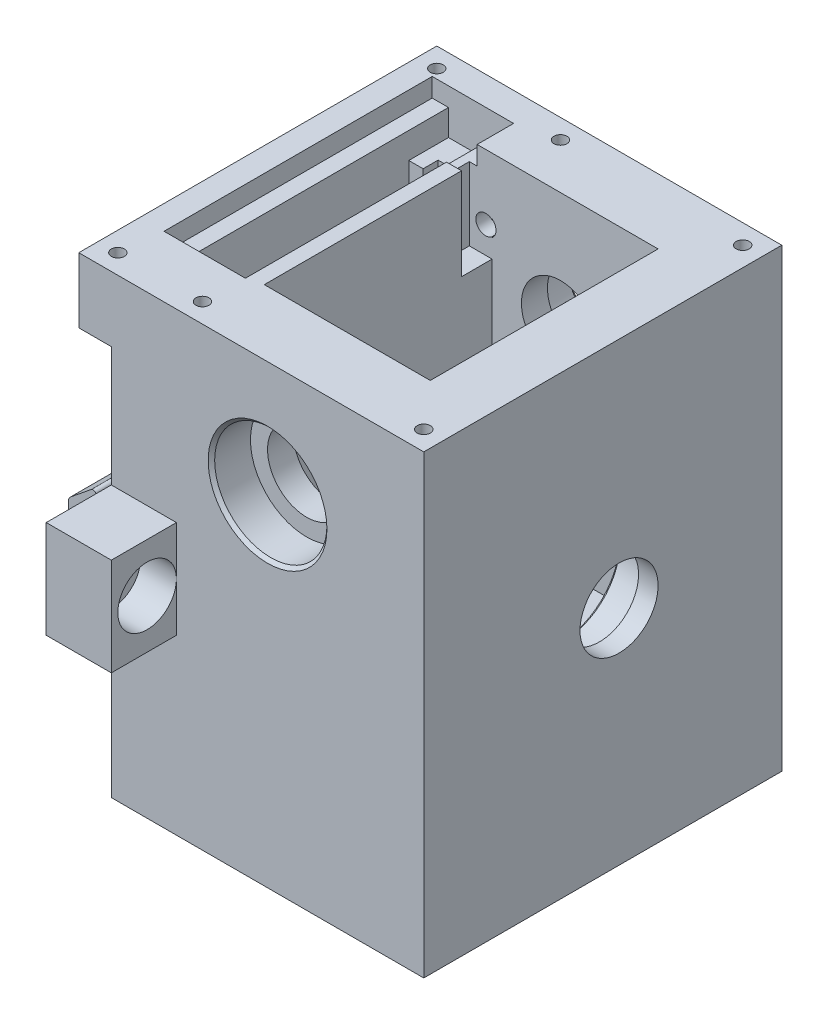
from build123d import *

# Parameters (mm, degrees)
SKETCH1_W            = 48
SKETCH1_H            = 70
BOSS_EXTRUDE1_DEPTH  = 80
SKETCH2_W            = 33
SKETCH2_H            = 69.5
CUT_EXTRUDE1_DEPTH   = 62.5
SKETCH3_W            = 2.3
SKETCH3_H            = 5
BOSS_EXTRUDE2_DEPTH  = 80
SKETCH5_W            = 4.3
SKETCH5_H            = 12
BOSS_EXTRUDE4_DEPTH  = 80
CUT_EXTRUDE2_DEPTH   = 80
CUT_EXTRUDE3_DEPTH   = 80
FILLET1_R            = 1
FILLET2_R            = 1
FILLET3_R            = 0.5
FILLET4_R            = 0.5
SKETCH9_W            = 13
SKETCH9_H            = 62.5
CUT_EXTRUDE4_DEPTH   = 10
SKETCH10_R           = 1.6
CUT_EXTRUDE5_DEPTH   = 20
SKETCH11_R           = 1.6
CUT_EXTRUDE6_DEPTH   = 10
SKETCH12_R           = 1.6
CUT_EXTRUDE7_DEPTH   = 10
SKETCH13_R           = 1.6
CUT_EXTRUDE8_DEPTH   = 10
BOSS_EXTRUDE5_DEPTH  = 62.5
SKETCH10_2_R         = 1.6
CUT_EXTRUDE9_DEPTH   = 39.5
SKETCH11_2_R         = 1.6
CUT_EXTRUDE10_DEPTH  = 39.5
SKETCH12_2_R         = 1.6
CUT_EXTRUDE11_DEPTH  = 39.5
SKETCH13_2_R         = 1.6
CUT_EXTRUDE12_DEPTH  = 39.5
SKETCH18_R           = 8.625
CUT_EXTRUDE14_DEPTH  = 48
SKETCH19_W           = 61.257664064
SKETCH19_H           = 71.270088678
CUT_EXTRUDE15_DEPTH  = 25
SKETCH20_W           = 33
SKETCH20_H           = 8
BOSS_EXTRUDE6_DEPTH  = 62.5
SKETCH16_R           = 8.625
CUT_EXTRUDE13_DEPTH  = 89.5
SKETCH28_R           = 11.5
BOSS_EXTRUDE8_DEPTH  = 11
SKETCH30_W           = 47.795163584
SKETCH30_H           = 26.72
BOSS_EXTRUDE9_DEPTH  = 11
SKETCH18_2_R         = 8.625
CUT_EXTRUDE17_DEPTH  = 45
SKETCH31_W           = 26.665859589
SKETCH31_H           = 27.00483238
BOSS_EXTRUDE10_DEPTH = 7.5
SKETCH32_R           = 9.5
BOSS_EXTRUDE11_DEPTH = 4
SKETCH35_R           = 2.5
CUT_EXTRUDE20_DEPTH  = 3
BOSS_EXTRUDE12_START = 6
BOSS_EXTRUDE12_DEPTH = 6
SKETCH48_R           = 8.675
CUT_EXTRUDE30_DEPTH  = 7
CHAMFER1_SIZE        = 0.5
SKETCH49_W           = 7.2
SKETCH49_H           = 28.2
CUT_EXTRUDE31_DEPTH  = 47.98
SKETCH50_W           = 7.2
SKETCH50_H           = 6
CUT_EXTRUDE32_DEPTH  = 6.88
SKETCH51_W           = 7.2
SKETCH51_H           = 6
CUT_EXTRUDE33_DEPTH  = 6.88
CHAMFER3_SIZE        = 1
SKETCH56_W           = 4.696998891
SKETCH56_H           = 14.096677865
CUT_EXTRUDE38_DEPTH  = 3.5
SKETCH57_R           = 1.5
CUT_EXTRUDE39_DEPTH  = 8
SKETCH58_W           = 55
SKETCH58_H           = 10
BOSS_EXTRUDE13_DEPTH = 5
SKETCH59_W           = 46.671424446
SKETCH59_H           = 12.802635134
BOSS_EXTRUDE14_DEPTH = 25
SKETCH12_3_R         = 1.6
CUT_EXTRUDE41_DEPTH  = 12
SKETCH61_R           = 1
CUT_EXTRUDE42_DEPTH  = 10
SKETCH62_R           = 1
CUT_EXTRUDE43_DEPTH  = 10
SKETCH63_R           = 1
CUT_EXTRUDE44_DEPTH  = 10
SKETCH64_R           = 1
CUT_EXTRUDE45_DEPTH  = 10
SKETCH65_R           = 1
CUT_EXTRUDE46_DEPTH  = 10
SKETCH66_R           = 1
CUT_EXTRUDE47_DEPTH  = 10
SKETCH67_W           = 10
SKETCH67_H           = 10
CUT_EXTRUDE48_DEPTH  = 15
SKETCH68_W           = 10
SKETCH68_H           = 10
CUT_EXTRUDE49_DEPTH  = 15
SKETCH13_3_R         = 1.6
CUT_EXTRUDE50_DEPTH  = 15
SKETCH69_W           = 0.2
SKETCH69_H           = 40.2
CUT_EXTRUDE51_DEPTH  = 47.98
SKETCH71_W           = 0.2
SKETCH71_H           = 6
BOSS_EXTRUDE15_DEPTH = 41.1
SKETCH72_W           = 0.2
SKETCH72_H           = 6
BOSS_EXTRUDE16_DEPTH = 41.1
SKETCH73_W           = 0.2
SKETCH73_H           = 40.2
CUT_EXTRUDE52_DEPTH  = 47.98
SKETCH74_W           = 0.2
SKETCH74_H           = 6
BOSS_EXTRUDE17_DEPTH = 41.1
SKETCH75_W           = 0.2
SKETCH75_H           = 6
BOSS_EXTRUDE18_DEPTH = 41.1
SKETCH76_W           = 7.6
SKETCH76_H           = 0.4
CUT_EXTRUDE53_DEPTH  = 41.1
SKETCH77_W           = 7.6
SKETCH77_H           = 0.4
CUT_EXTRUDE54_DEPTH  = 41.1
SKETCH81_W           = 44.833246721
SKETCH81_H           = 50.686044519
BOSS_EXTRUDE19_DEPTH = 1.5
SKETCH18_3_R         = 8.625
CUT_EXTRUDE57_DEPTH  = 12
SKETCH82_W           = 10
SKETCH82_H           = 15
BOSS_EXTRUDE20_DEPTH = 15
SKETCH85_W           = 7.6
SKETCH85_H           = 0.5
CUT_EXTRUDE60_DEPTH  = 6.88
SKETCH86_W           = 7.6
SKETCH86_H           = 0.5
CUT_EXTRUDE61_DEPTH  = 6.88
SKETCH87_R           = 4.5
CUT_EXTRUDE62_DEPTH  = 5.5
SKETCH88_R           = 2.5
CUT_EXTRUDE63_DEPTH  = 5.5
SKETCH89_W           = 5
SKETCH89_H           = 15
CUT_EXTRUDE64_DEPTH  = 15.5
SKETCH96_W           = 2.4
SKETCH96_H           = 2.3
CUT_EXTRUDE69_DEPTH  = 41
SKETCH97_W           = 2.4
SKETCH97_H           = 2.3
CUT_EXTRUDE70_DEPTH  = 41
SKETCH98_R           = 1
CUT_EXTRUDE71_DEPTH  = 10
SKETCH99_R           = 1
CUT_EXTRUDE72_DEPTH  = 10
SKETCH101_W          = 43.155587502
SKETCH101_H          = 54.303115044
BOSS_EXTRUDE23_DEPTH = 0.1
SKETCH105_R          = 8.625
BOSS_EXTRUDE26_DEPTH = 2
BOSS_EXTRUDE27_START = -2
SKETCH106_R          = 8.625
BOSS_EXTRUDE27_DEPTH = 2
SKETCH107_R          = 6
CUT_EXTRUDE74_DEPTH  = 52
CHAMFER4_SIZE        = 0.5
CHAMFER5_SIZE        = 0.5
CHAMFER6_SIZE        = 0.5
SKETCH108_R          = 8.675
BOSS_EXTRUDE28_DEPTH = 3
SKETCH110_R          = 6
CUT_EXTRUDE75_DEPTH  = 3
SKETCH111_W          = 2.5
SKETCH111_H          = 41.2
CUT_EXTRUDE76_DEPTH  = 2.88
SKETCH112_W          = 2.5
SKETCH112_H          = 41.2
CUT_EXTRUDE77_DEPTH  = 2.88
BOSS_EXTRUDE30_START = 0.8
SKETCH114_R          = 8.675
SKETCH114_R_2        = 2.5
BOSS_EXTRUDE30_DEPTH = 0.8
CHAMFER7_SIZE        = 0.5
CHAMFER8_SIZE        = 0.5
SKETCH115_R          = 6
SKETCH115_R_2        = 1.6
BOSS_EXTRUDE31_DEPTH = 2
CUT_EXTRUDE78_DEPTH  = 2
SKETCH117_R          = 6
BOSS_EXTRUDE32_DEPTH = 2
SKETCH119_R          = 1.6
CUT_EXTRUDE80_DEPTH  = 10


with BuildPart() as part:
    # Sketch1 → Boss-Extrude1 (new body)
    with BuildSketch(Plane.XY):
        with Locations((24, 35)):
            Rectangle(SKETCH1_W, SKETCH1_H)
    extrude(amount=BOSS_EXTRUDE1_DEPTH)

    # Sketch2 → Cut-Extrude1 (cut)
    with BuildSketch(Plane(origin=(0, 70, 0), x_dir=(1, 0, 0), z_dir=(0, 1, 0))):
        with Locations((24, -37.75)):
            Rectangle(SKETCH2_W, SKETCH2_H)
    extrude(amount=-CUT_EXTRUDE1_DEPTH, mode=Mode.SUBTRACT)

    # Sketch3 → Boss-Extrude2 (add)
    with BuildSketch(Plane.XY.offset(80)):
        with Locations((-1.15, 34.096547)):
            Rectangle(SKETCH3_W, SKETCH3_H)
    extrude(amount=-BOSS_EXTRUDE2_DEPTH)

    # Sketch5 → Boss-Extrude4 (add)
    with BuildSketch(Plane.XY.offset(80)):
        with Locations((-4.45, 34.096547)):
            Rectangle(SKETCH5_W, SKETCH5_H)
    extrude(amount=-BOSS_EXTRUDE4_DEPTH)

    # Sketch6 → Cut-Extrude2 (cut)
    with BuildSketch(Plane.XY.offset(80)):
        Polygon((-2.3, 40.096547), (-6.6, 36.596547), (-6.6, 40.096547), align=None)
    extrude(amount=-CUT_EXTRUDE2_DEPTH, mode=Mode.SUBTRACT)

    # Sketch7 → Cut-Extrude3 (cut)
    with BuildSketch(Plane.XY.offset(80)):
        Polygon((-6.6, 28.096547), (-2.3, 28.096547), (-6.6, 31.596547), align=None)
    extrude(amount=-CUT_EXTRUDE3_DEPTH, mode=Mode.SUBTRACT)

    # Fillet1
    fillet1_edges = [part.edges().sort_by_distance(p)[0] for p in [
        (-6.6, 36.596547, 40),
    ]]
    fillet(fillet1_edges, radius=FILLET1_R)

    # Fillet2
    fillet2_edges = [part.edges().sort_by_distance(p)[0] for p in [
        (-6.6, 31.596547, 40),
    ]]
    fillet(fillet2_edges, radius=FILLET2_R)

    # Fillet3
    fillet3_edges = [part.edges().sort_by_distance(p)[0] for p in [
        (-2.3, 40.096547, 40),
    ]]
    fillet(fillet3_edges, radius=FILLET3_R)

    # Fillet4
    fillet4_edges = [part.edges().sort_by_distance(p)[0] for p in [
        (-2.3, 28.096547, 40),
    ]]
    fillet(fillet4_edges, radius=FILLET4_R)

    # Sketch9 → Cut-Extrude4 (cut)
    with BuildSketch(Plane(origin=(0, 0, 0), x_dir=(-1, 0, 0), z_dir=(0, 0, -1))):
        with Locations((-24, 38.75)):
            Rectangle(SKETCH9_W, SKETCH9_H)
    extrude(amount=-CUT_EXTRUDE4_DEPTH, mode=Mode.SUBTRACT)

    # Sketch10 → Cut-Extrude5 (cut)
    with BuildSketch(Plane(origin=(0, 0, 0), x_dir=(-1, 0, 0), z_dir=(0, 0, -1))):
        with Locations((-12.5, 60)):
            Circle(SKETCH10_R)
    extrude(amount=-CUT_EXTRUDE5_DEPTH, mode=Mode.SUBTRACT)

    # Sketch11 → Cut-Extrude6 (cut)
    with BuildSketch(Plane(origin=(0, 0, 0), x_dir=(-1, 0, 0), z_dir=(0, 0, -1))):
        with Locations((-35.5, 60)):
            Circle(SKETCH11_R)
    extrude(amount=-CUT_EXTRUDE6_DEPTH, mode=Mode.SUBTRACT)

    # Sketch12 → Cut-Extrude7 (cut)
    with BuildSketch(Plane(origin=(0, 0, 0), x_dir=(-1, 0, 0), z_dir=(0, 0, -1))):
        with Locations((-12.5, 10)):
            Circle(SKETCH12_R)
    extrude(amount=-CUT_EXTRUDE7_DEPTH, mode=Mode.SUBTRACT)

    # Sketch13 → Cut-Extrude8 (cut)
    with BuildSketch(Plane(origin=(0, 0, 0), x_dir=(-1, 0, 0), z_dir=(0, 0, -1))):
        with Locations((-35.5, 10)):
            Circle(SKETCH13_R)
    extrude(amount=-CUT_EXTRUDE8_DEPTH, mode=Mode.SUBTRACT)

    # Sketch15 → Boss-Extrude5 (add)
    with BuildSketch(Plane(origin=(0, 7.5, 0), x_dir=(1, 0, 0), z_dir=(0, 1, 0))):
        Polygon((40.5, -3), (40.5, -8), (7.5, -8), (7.5, -3), (17.5, -3), (17.5, 0), (30.5, 0), (30.5, -3), align=None)
    extrude(amount=BOSS_EXTRUDE5_DEPTH)

    # Sketch10<2> → Cut-Extrude9 (cut)
    with BuildSketch(Plane(origin=(0, 0, 0), x_dir=(-1, 0, 0), z_dir=(0, 0, -1))):
        with Locations((-12.5, 60)):
            Circle(SKETCH10_2_R)
    extrude(amount=-CUT_EXTRUDE9_DEPTH, mode=Mode.SUBTRACT)

    # Sketch11<2> → Cut-Extrude10 (cut)
    with BuildSketch(Plane(origin=(0, 0, 0), x_dir=(-1, 0, 0), z_dir=(0, 0, -1))):
        with Locations((-35.5, 60)):
            Circle(SKETCH11_2_R)
    extrude(amount=-CUT_EXTRUDE10_DEPTH, mode=Mode.SUBTRACT)

    # Sketch12<2> → Cut-Extrude11 (cut)
    with BuildSketch(Plane(origin=(0, 0, 0), x_dir=(-1, 0, 0), z_dir=(0, 0, -1))):
        with Locations((-12.5, 10)):
            Circle(SKETCH12_2_R)
    extrude(amount=-CUT_EXTRUDE11_DEPTH, mode=Mode.SUBTRACT)

    # Sketch13<2> → Cut-Extrude12 (cut)
    with BuildSketch(Plane(origin=(0, 0, 0), x_dir=(-1, 0, 0), z_dir=(0, 0, -1))):
        with Locations((-35.5, 10)):
            Circle(SKETCH13_2_R)
    extrude(amount=-CUT_EXTRUDE12_DEPTH, mode=Mode.SUBTRACT)

    # Sketch18 → Cut-Extrude14 (cut)
    with BuildSketch(Plane(origin=(48, 0, 0), x_dir=(0, 0, -1), z_dir=(1, 0, 0))):
        with Locations(Location((-25, 34.22, 0), (0, 0, 15.994297416))):
            Circle(SKETCH18_R)
    extrude(amount=-CUT_EXTRUDE14_DEPTH, mode=Mode.SUBTRACT)

    # Sketch19 → Cut-Extrude15 (cut)
    with BuildSketch(Plane.XY.offset(80)):
        with Locations((17.371167968, 35.635044339)):
            Rectangle(SKETCH19_W, SKETCH19_H)
    extrude(amount=-CUT_EXTRUDE15_DEPTH, mode=Mode.SUBTRACT)

    # Sketch20 → Boss-Extrude6 (add)
    with BuildSketch(Plane(origin=(0, 7.5, 0), x_dir=(1, 0, 0), z_dir=(0, 1, 0))):
        with Locations((24, -51)):
            Rectangle(SKETCH20_W, SKETCH20_H)
    extrude(amount=BOSS_EXTRUDE6_DEPTH)

    # Sketch16 → Cut-Extrude13 (cut)
    with BuildSketch(Plane(origin=(0, 0, 0), x_dir=(-1, 0, 0), z_dir=(0, 0, -1))):
        with Locations((-24, 52.3)):
            Circle(SKETCH16_R)
    extrude(amount=-CUT_EXTRUDE13_DEPTH, mode=Mode.SUBTRACT)

    # Sketch28 → Boss-Extrude8 (add)
    with BuildSketch(Plane(origin=(7.5, 0, 0), x_dir=(0, 0, -1), z_dir=(1, 0, 0))):
        with Locations(Location((-25, 34.22, 0), (0, 0, 180))):
            Circle(SKETCH28_R)
    extrude(amount=BOSS_EXTRUDE8_DEPTH)

    # Sketch30 → Boss-Extrude9 (add)
    with BuildSketch(Plane(origin=(7.5, 0, 0), x_dir=(0, 0, -1), z_dir=(1, 0, 0))):
        with Locations((-27.782477326, 20.86)):
            Rectangle(SKETCH30_W, SKETCH30_H)
    extrude(amount=BOSS_EXTRUDE9_DEPTH)

    # Sketch18<2> → Cut-Extrude17 (cut)
    with BuildSketch(Plane(origin=(48, 0, 0), x_dir=(0, 0, -1), z_dir=(1, 0, 0))):
        with Locations((-25, 34.22)):
            Circle(SKETCH18_2_R)
    extrude(amount=-CUT_EXTRUDE17_DEPTH, mode=Mode.SUBTRACT)

    # Sketch31 → Boss-Extrude10 (add)
    with BuildSketch(Plane.ZY):
        with Locations((25.47457292, 33.7006043)):
            Rectangle(SKETCH31_W, SKETCH31_H)
    extrude(amount=-BOSS_EXTRUDE10_DEPTH)

    # Sketch32 → Boss-Extrude11 (add)
    with BuildSketch(Plane(origin=(7.5, 0, 0), x_dir=(0, 0, -1), z_dir=(1, 0, 0))):
        with Locations((-25, 34.22)):
            Circle(SKETCH32_R)
    extrude(amount=BOSS_EXTRUDE11_DEPTH)

    # Sketch35 → Cut-Extrude20 (cut)
    with BuildSketch(Plane(origin=(11.5, 0, 0), x_dir=(0, 0, -1), z_dir=(1, 0, 0))):
        with Locations((-25, 34.22)):
            Circle(SKETCH35_R)
    extrude(amount=-CUT_EXTRUDE20_DEPTH, mode=Mode.SUBTRACT)

    # Sketch38 → Boss-Extrude12 (add)
    with BuildSketch(Plane(origin=(7.5, 0, 0), x_dir=(0, 0, -1), z_dir=(1, 0, 0)).offset(BOSS_EXTRUDE12_START)):
        with BuildLine():
            Line((-33.625, 34.22), (-55, 34.22))
            Line((-55, 34.22), (-55, 70))
            Line((-55, 70), (0, 70))
            Line((0, 70), (0, 34.22))
            Line((0, 34.22), (-16.375, 34.22))
            ThreePointArc((-16.375, 34.22), (-25, 42.845), (-33.625, 34.22))
        make_face()
    extrude(amount=-BOSS_EXTRUDE12_DEPTH)

    # Sketch48 → Cut-Extrude30 (cut)
    with BuildSketch(Plane(origin=(18.5, 0, 0), x_dir=(0, 0, -1), z_dir=(1, 0, 0))):
        with Locations((-25, 34.22)):
            Circle(SKETCH48_R)
    extrude(amount=-CUT_EXTRUDE30_DEPTH, mode=Mode.SUBTRACT)

    # Chamfer1
    chamfer1_edges = [part.edges().sort_by_distance(p)[0] for p in [
        (18.5, 34.22, 33.675),
    ]]
    chamfer(chamfer1_edges, length=CHAMFER1_SIZE)

    # Sketch49 → Cut-Extrude31 (cut)
    with BuildSketch(Plane(origin=(0, 70, 0), x_dir=(1, 0, 0), z_dir=(0, 1, 0))):
        with Locations((4.9, -25)):
            Rectangle(SKETCH49_W, SKETCH49_H)
    extrude(amount=-CUT_EXTRUDE31_DEPTH, mode=Mode.SUBTRACT)

    # Sketch50 → Cut-Extrude32 (cut)
    with BuildSketch(Plane(origin=(0, 70, 0), x_dir=(1, 0, 0), z_dir=(0, 1, 0))):
        with Locations((4.9, -7.9)):
            Rectangle(SKETCH50_W, SKETCH50_H)
    extrude(amount=-CUT_EXTRUDE32_DEPTH, mode=Mode.SUBTRACT)

    # Sketch51 → Cut-Extrude33 (cut)
    with BuildSketch(Plane(origin=(0, 70, 0), x_dir=(1, 0, 0), z_dir=(0, 1, 0))):
        with Locations((4.9, -42.1)):
            Rectangle(SKETCH51_W, SKETCH51_H)
    extrude(amount=-CUT_EXTRUDE33_DEPTH, mode=Mode.SUBTRACT)

    # Chamfer3
    chamfer3_edges = [part.edges().sort_by_distance(p)[0] for p in [
        (18.5, 45.72, 25),
    ]]
    chamfer(chamfer3_edges, length=CHAMFER3_SIZE)

    # Sketch56 → Cut-Extrude38 (cut)
    with BuildSketch(Plane(origin=(13.5, 0, 0), x_dir=(0, 0, -1), z_dir=(1, 0, 0))):
        with Locations((-10.348499445, 62.951661067)):
            Rectangle(SKETCH56_W, SKETCH56_H)
    extrude(amount=-CUT_EXTRUDE38_DEPTH, mode=Mode.SUBTRACT)

    # Sketch57 → Cut-Extrude39 (cut)
    with BuildSketch(Plane(origin=(0, 0, 0), x_dir=(-1, 0, 0), z_dir=(0, 0, -1))):
        with Locations((-12.5, 60)):
            Circle(SKETCH57_R)
    extrude(amount=-CUT_EXTRUDE39_DEPTH, mode=Mode.SUBTRACT)

    # Sketch58 → Boss-Extrude13 (add)
    with BuildSketch(Plane.ZY):
        with Locations((27.5, 65)):
            Rectangle(SKETCH58_W, SKETCH58_H)
    extrude(amount=BOSS_EXTRUDE13_DEPTH)

    # Sketch59 → Boss-Extrude14 (add)
    with BuildSketch(Plane(origin=(18.5, 0, 0), x_dir=(0, 0, -1), z_dir=(1, 0, 0))):
        with Locations((-28.603153, 13.347248395)):
            Rectangle(SKETCH59_W, SKETCH59_H)
    extrude(amount=BOSS_EXTRUDE14_DEPTH)

    # Sketch12<3> → Cut-Extrude41 (cut)
    with BuildSketch(Plane(origin=(0, 0, 0), x_dir=(-1, 0, 0), z_dir=(0, 0, -1))):
        with Locations((-12.5, 10)):
            Circle(SKETCH12_3_R)
    extrude(amount=-CUT_EXTRUDE41_DEPTH, mode=Mode.SUBTRACT)

    # Sketch61 → Cut-Extrude42 (cut)
    with BuildSketch(Plane(origin=(0, 70, 0), x_dir=(1, 0, 0), z_dir=(0, 1, 0))):
        with Locations(Location((45, -52, 0), (0, 0, 270))):
            Circle(SKETCH61_R)
    extrude(amount=-CUT_EXTRUDE42_DEPTH, mode=Mode.SUBTRACT)

    # Sketch62 → Cut-Extrude43 (cut)
    with BuildSketch(Plane(origin=(0, 70, 0), x_dir=(1, 0, 0), z_dir=(0, 1, 0))):
        with Locations(Location((45, -3, 0), (0, 0, 270))):
            Circle(SKETCH62_R)
    extrude(amount=-CUT_EXTRUDE43_DEPTH, mode=Mode.SUBTRACT)

    # Sketch63 → Cut-Extrude44 (cut)
    with BuildSketch(Plane(origin=(0, 70, 0), x_dir=(1, 0, 0), z_dir=(0, 1, 0))):
        with Locations(Location((17, -3, 0), (0, 0, 270))):
            Circle(SKETCH63_R)
    extrude(amount=-CUT_EXTRUDE44_DEPTH, mode=Mode.SUBTRACT)

    # Sketch64 → Cut-Extrude45 (cut)
    with BuildSketch(Plane(origin=(0, 70, 0), x_dir=(1, 0, 0), z_dir=(0, 1, 0))):
        with Locations(Location((11, -52, 0), (0, 0, 270))):
            Circle(SKETCH64_R)
    extrude(amount=-CUT_EXTRUDE45_DEPTH, mode=Mode.SUBTRACT)

    # Sketch65 → Cut-Extrude46 (cut)
    with BuildSketch(Plane(origin=(0, 70, 0), x_dir=(1, 0, 0), z_dir=(0, 1, 0))):
        with Locations(Location((-2, -52, 0), (0, 0, 270))):
            Circle(SKETCH65_R)
    extrude(amount=-CUT_EXTRUDE46_DEPTH, mode=Mode.SUBTRACT)

    # Sketch66 → Cut-Extrude47 (cut)
    with BuildSketch(Plane(origin=(0, 70, 0), x_dir=(1, 0, 0), z_dir=(0, 1, 0))):
        with Locations(Location((-2, -3, 0), (0, 0, 270))):
            Circle(SKETCH66_R)
    extrude(amount=-CUT_EXTRUDE47_DEPTH, mode=Mode.SUBTRACT)

    # Sketch67 → Cut-Extrude48 (cut)
    with BuildSketch(Plane.XZ):
        with Locations((13, 13)):
            Rectangle(SKETCH67_W, SKETCH67_H)
    extrude(amount=-CUT_EXTRUDE48_DEPTH, mode=Mode.SUBTRACT)

    # Sketch68 → Cut-Extrude49 (cut)
    with BuildSketch(Plane.XZ):
        with Locations((35, 13)):
            Rectangle(SKETCH68_W, SKETCH68_H)
    extrude(amount=-CUT_EXTRUDE49_DEPTH, mode=Mode.SUBTRACT)

    # Sketch13<3> → Cut-Extrude50 (cut)
    with BuildSketch(Plane(origin=(0, 0, 0), x_dir=(-1, 0, 0), z_dir=(0, 0, -1))):
        with Locations((-35.5, 10)):
            Circle(SKETCH13_3_R)
    extrude(amount=-CUT_EXTRUDE50_DEPTH, mode=Mode.SUBTRACT)

    # Sketch69 → Cut-Extrude51 (cut)
    with BuildSketch(Plane(origin=(0, 70, 0), x_dir=(1, 0, 0), z_dir=(0, 1, 0))):
        with Locations((8.6, -25)):
            Rectangle(SKETCH69_W, SKETCH69_H)
    extrude(amount=-CUT_EXTRUDE51_DEPTH, mode=Mode.SUBTRACT)

    # Sketch71 → Boss-Extrude15 (add)
    with BuildSketch(Plane(origin=(0, 22.02, 0), x_dir=(1, 0, 0), z_dir=(0, 1, 0))):
        with Locations((8.6, -42.1)):
            Rectangle(SKETCH71_W, SKETCH71_H)
    extrude(amount=BOSS_EXTRUDE15_DEPTH)

    # Sketch72 → Boss-Extrude16 (add)
    with BuildSketch(Plane(origin=(0, 22.02, 0), x_dir=(1, 0, 0), z_dir=(0, 1, 0))):
        with Locations((8.6, -7.9)):
            Rectangle(SKETCH72_W, SKETCH72_H)
    extrude(amount=BOSS_EXTRUDE16_DEPTH)

    # Sketch73 → Cut-Extrude52 (cut)
    with BuildSketch(Plane(origin=(0, 70, 0), x_dir=(1, 0, 0), z_dir=(0, 1, 0))):
        with Locations((1.2, -25)):
            Rectangle(SKETCH73_W, SKETCH73_H)
    extrude(amount=-CUT_EXTRUDE52_DEPTH, mode=Mode.SUBTRACT)

    # Sketch74 → Boss-Extrude17 (add)
    with BuildSketch(Plane(origin=(0, 22.02, 0), x_dir=(1, 0, 0), z_dir=(0, 1, 0))):
        with Locations((1.2, -7.9)):
            Rectangle(SKETCH74_W, SKETCH74_H)
    extrude(amount=BOSS_EXTRUDE17_DEPTH)

    # Sketch75 → Boss-Extrude18 (add)
    with BuildSketch(Plane(origin=(0, 22.02, 0), x_dir=(1, 0, 0), z_dir=(0, 1, 0))):
        with Locations((1.2, -42.1)):
            Rectangle(SKETCH75_W, SKETCH75_H)
    extrude(amount=BOSS_EXTRUDE18_DEPTH)

    # Sketch76 → Cut-Extrude53 (cut)
    with BuildSketch(Plane(origin=(0, 63.12, 0), x_dir=(1, 0, 0), z_dir=(0, 1, 0))):
        with Locations((4.9, -10.7)):
            Rectangle(SKETCH76_W, SKETCH76_H)
    extrude(amount=-CUT_EXTRUDE53_DEPTH, mode=Mode.SUBTRACT)

    # Sketch77 → Cut-Extrude54 (cut)
    with BuildSketch(Plane(origin=(0, 63.12, 0), x_dir=(1, 0, 0), z_dir=(0, 1, 0))):
        with Locations((4.9, -39.3)):
            Rectangle(SKETCH77_W, SKETCH77_H)
    extrude(amount=-CUT_EXTRUDE54_DEPTH, mode=Mode.SUBTRACT)

    # Sketch81 → Boss-Extrude19 (add)
    with BuildSketch(Plane.ZY.offset(-40.5)):
        with Locations((27.31662336, 44.65697774)):
            Rectangle(SKETCH81_W, SKETCH81_H)
    extrude(amount=BOSS_EXTRUDE19_DEPTH)

    # Sketch18<3> → Cut-Extrude57 (cut)
    with BuildSketch(Plane(origin=(48, 0, 0), x_dir=(0, 0, -1), z_dir=(1, 0, 0))):
        with Locations((-25, 34.22)):
            Circle(SKETCH18_3_R)
    extrude(amount=-CUT_EXTRUDE57_DEPTH, mode=Mode.SUBTRACT)

    # Sketch82 → Boss-Extrude20 (add)
    with BuildSketch(Plane.XY.offset(55)):
        with Locations((5, 34.096547)):
            Rectangle(SKETCH82_W, SKETCH82_H)
    extrude(amount=BOSS_EXTRUDE20_DEPTH)

    # Sketch85 → Cut-Extrude60 (cut)
    with BuildSketch(Plane(origin=(0, 70, 0), x_dir=(1, 0, 0), z_dir=(0, 1, 0))):
        with Locations((4.9, -4.65)):
            Rectangle(SKETCH85_W, SKETCH85_H)
    extrude(amount=-CUT_EXTRUDE60_DEPTH, mode=Mode.SUBTRACT)

    # Sketch86 → Cut-Extrude61 (cut)
    with BuildSketch(Plane(origin=(0, 70, 0), x_dir=(1, 0, 0), z_dir=(0, 1, 0))):
        with Locations((4.9, -45.35)):
            Rectangle(SKETCH86_W, SKETCH86_H)
    extrude(amount=-CUT_EXTRUDE61_DEPTH, mode=Mode.SUBTRACT)

    # Sketch87 → Cut-Extrude62 (cut)
    with BuildSketch(Plane(origin=(10, 0, 0), x_dir=(0, 0, -1), z_dir=(1, 0, 0))):
        with Locations(Location((-59.5, 34.096547, 0), (0, 0, 90))):
            Circle(SKETCH87_R)
    extrude(amount=-CUT_EXTRUDE62_DEPTH, mode=Mode.SUBTRACT)

    # Sketch88 → Cut-Extrude63 (cut)
    with BuildSketch(Plane(origin=(4.5, 0, 0), x_dir=(0, 0, -1), z_dir=(1, 0, 0))):
        with Locations(Location((-59.5, 34.096547, 0), (0, 0, 90))):
            Circle(SKETCH88_R)
    extrude(amount=-CUT_EXTRUDE63_DEPTH, mode=Mode.SUBTRACT)

    # Sketch89 → Cut-Extrude64 (cut)
    with BuildSketch(Plane(origin=(10, 0, 0), x_dir=(0, 0, -1), z_dir=(1, 0, 0))):
        with Locations((-67.5, 34.096547)):
            Rectangle(SKETCH89_W, SKETCH89_H)
    extrude(amount=-CUT_EXTRUDE64_DEPTH, mode=Mode.SUBTRACT)

    # Sketch96 → Cut-Extrude69 (cut)
    with BuildSketch(Plane(origin=(0, 63.12, 0), x_dir=(1, 0, 0), z_dir=(0, 1, 0))):
        with Locations((4.6, -9.35)):
            Rectangle(SKETCH96_W, SKETCH96_H)
    extrude(amount=-CUT_EXTRUDE69_DEPTH, mode=Mode.SUBTRACT)

    # Sketch97 → Cut-Extrude70 (cut)
    with BuildSketch(Plane(origin=(0, 63.12, 0), x_dir=(1, 0, 0), z_dir=(0, 1, 0))):
        with Locations((4.6, -40.65)):
            Rectangle(SKETCH97_W, SKETCH97_H)
    extrude(amount=-CUT_EXTRUDE70_DEPTH, mode=Mode.SUBTRACT)

    # Sketch98 → Cut-Extrude71 (cut)
    with BuildSketch(Plane(origin=(0, 63.12, 0), x_dir=(1, 0, 0), z_dir=(0, 1, 0))):
        with Locations(Location((6.6, -42.8, 0), (0, 0, 270))):
            Circle(SKETCH98_R)
    extrude(amount=-CUT_EXTRUDE71_DEPTH, mode=Mode.SUBTRACT)

    # Sketch99 → Cut-Extrude72 (cut)
    with BuildSketch(Plane(origin=(0, 63.12, 0), x_dir=(1, 0, 0), z_dir=(0, 1, 0))):
        with Locations(Location((6.6, -7.2, 0), (0, 0, 270))):
            Circle(SKETCH99_R)
    extrude(amount=-CUT_EXTRUDE72_DEPTH, mode=Mode.SUBTRACT)

    # Sketch101 → Boss-Extrude23 (add)
    with BuildSketch(Plane(origin=(1.1, 0, 0), x_dir=(0, 0, -1), z_dir=(1, 0, 0))):
        with Locations((-24.022206249, 42.848442478)):
            Rectangle(SKETCH101_W, SKETCH101_H)
    extrude(amount=BOSS_EXTRUDE23_DEPTH)

    # Sketch105 → Boss-Extrude26 (add)
    with BuildSketch(Plane(origin=(0, 0, 47), x_dir=(-1, 0, 0), z_dir=(0, 0, -1))):
        with Locations((-24, 52.3)):
            Circle(SKETCH105_R)
    extrude(amount=-BOSS_EXTRUDE26_DEPTH)

    # Sketch106 → Boss-Extrude27 (add)
    with BuildSketch(Plane.XY.offset(8).offset(BOSS_EXTRUDE27_START)):
        with Locations(Location((24, 52.3, 0), (0, 0, 180))):
            Circle(SKETCH106_R)
    extrude(amount=BOSS_EXTRUDE27_DEPTH)

    # Sketch107 → Cut-Extrude74 (cut)
    with BuildSketch(Plane.XY.offset(49)):
        with Locations((24, 52.3)):
            Circle(SKETCH107_R)
    extrude(amount=-CUT_EXTRUDE74_DEPTH, mode=Mode.SUBTRACT)

    # Chamfer4
    chamfer4_edges = [part.edges().sort_by_distance(p)[0] for p in [
        (32.625, 52.3, 0),
    ]]
    chamfer(chamfer4_edges, length=CHAMFER4_SIZE)

    # Chamfer5
    chamfer5_edges = [part.edges().sort_by_distance(p)[0] for p in [
        (32.625, 52.3, 55),
    ]]
    chamfer(chamfer5_edges, length=CHAMFER5_SIZE)

    # Chamfer6
    chamfer6_edges = [part.edges().sort_by_distance(p)[0] for p in [
        (39, 34.22, 33.625),
    ]]
    chamfer(chamfer6_edges, length=CHAMFER6_SIZE)

    # Sketch108 → Boss-Extrude28 (add)
    with BuildSketch(Plane(origin=(48, 0, 0), x_dir=(0, 0, -1), z_dir=(1, 0, 0))):
        with Locations((-25, 34.22)):
            Circle(SKETCH108_R)
    extrude(amount=-BOSS_EXTRUDE28_DEPTH)

    # Sketch110 → Cut-Extrude75 (cut)
    with BuildSketch(Plane.ZY.offset(-45)):
        with Locations((25, 34.22)):
            Circle(SKETCH110_R)
    extrude(amount=-CUT_EXTRUDE75_DEPTH, mode=Mode.SUBTRACT)

    # Sketch111 → Cut-Extrude76 (cut)
    with BuildSketch(Plane(origin=(0, 70, 0), x_dir=(1, 0, 0), z_dir=(0, 1, 0))):
        with Locations((-0.05, -25)):
            Rectangle(SKETCH111_W, SKETCH111_H)
    extrude(amount=-CUT_EXTRUDE76_DEPTH, mode=Mode.SUBTRACT)

    # Sketch112 → Cut-Extrude77 (cut)
    with BuildSketch(Plane(origin=(0, 70, 0), x_dir=(1, 0, 0), z_dir=(0, 1, 0))):
        with Locations((9.95, -25)):
            Rectangle(SKETCH112_W, SKETCH112_H)
    extrude(amount=-CUT_EXTRUDE77_DEPTH, mode=Mode.SUBTRACT)

    # Sketch114 → Boss-Extrude30 (add)
    with BuildSketch(Plane(origin=(11.5, 0, 0), x_dir=(0, 0, -1), z_dir=(1, 0, 0)).offset(BOSS_EXTRUDE30_START)):
        with Locations((-25, 34.22)):
            Circle(SKETCH114_R)
        with Locations((-25, 34.22)):
            Circle(SKETCH114_R_2, mode=Mode.SUBTRACT)
    extrude(amount=-BOSS_EXTRUDE30_DEPTH)

    # Chamfer7
    chamfer7_edges = [part.edges().sort_by_distance(p)[0] for p in [
        (12.3, 34.22, 27.5),
    ]]
    chamfer(chamfer7_edges, length=CHAMFER7_SIZE)

    # Chamfer8
    chamfer8_edges = [part.edges().sort_by_distance(p)[0] for p in [
        (8.7, 34.22, 27.5),
    ]]
    chamfer(chamfer8_edges, length=CHAMFER8_SIZE)

    # Sketch115 → Boss-Extrude31 (add)
    with BuildSketch(Plane.XY.offset(8)):
        Polygon((39, 19.748565962), (39, 70), (11.2, 70), (11.2, 67.12), (10, 67.12), (10, 55.903322135), (13.5, 55.903322135), (13.5, 34.22), (18.5, 34.22), (18.5, 19.748565962), align=None)
        with BuildLine():
            ThreePointArc((13.5, 61.2489996), (14.1, 60), (13.5, 58.7510004))
            Line((13.5, 58.7510004), (13.5, 58.881966011))
            ThreePointArc((13.5, 58.881966011), (11, 60), (13.5, 61.118033989))
            Line((13.5, 61.118033989), (13.5, 61.2489996))
        make_face(mode=Mode.SUBTRACT)
        with Locations((24, 52.3)):
            Circle(SKETCH115_R, mode=Mode.SUBTRACT)
        with Locations(Location((35.5, 60, 0), (0, 0, 180))):
            Circle(SKETCH115_R_2, mode=Mode.SUBTRACT)
    extrude(amount=BOSS_EXTRUDE31_DEPTH)

    # Sketch116 → Cut-Extrude78 (cut)
    with BuildSketch(Plane(origin=(0, 0, 12.696998891), x_dir=(-1, 0, 0), z_dir=(0, 0, -1))):
        Polygon((-10, 67.12), (-11.2, 67.12), (-11.2, 70), (-13.5, 70), (-13.5, 55.903322135), (-10, 55.903322135), align=None)
    extrude(amount=-CUT_EXTRUDE78_DEPTH, mode=Mode.SUBTRACT)

    # Sketch117 → Boss-Extrude32 (add)
    with BuildSketch(Plane(origin=(0, 0, 47), x_dir=(-1, 0, 0), z_dir=(0, 0, -1))):
        Polygon((-13.5, 70), (-39, 70), (-39, 19.748565962), (-18.5, 19.748565962), (-18.5, 34.22), (-13.5, 34.22), align=None)
        with Locations(Location((-24, 52.3, 0), (0, 0, 180))):
            Circle(SKETCH117_R, mode=Mode.SUBTRACT)
    extrude(amount=BOSS_EXTRUDE32_DEPTH)

    # Sketch119 → Cut-Extrude80 (cut)
    with BuildSketch(Plane(origin=(1.2, 0, 0), x_dir=(0, 0, -1), z_dir=(1, 0, 0))):
        with Locations((-25, 34.22)):
            Circle(SKETCH119_R)
    extrude(amount=-CUT_EXTRUDE80_DEPTH, mode=Mode.SUBTRACT)


solid = part.part
